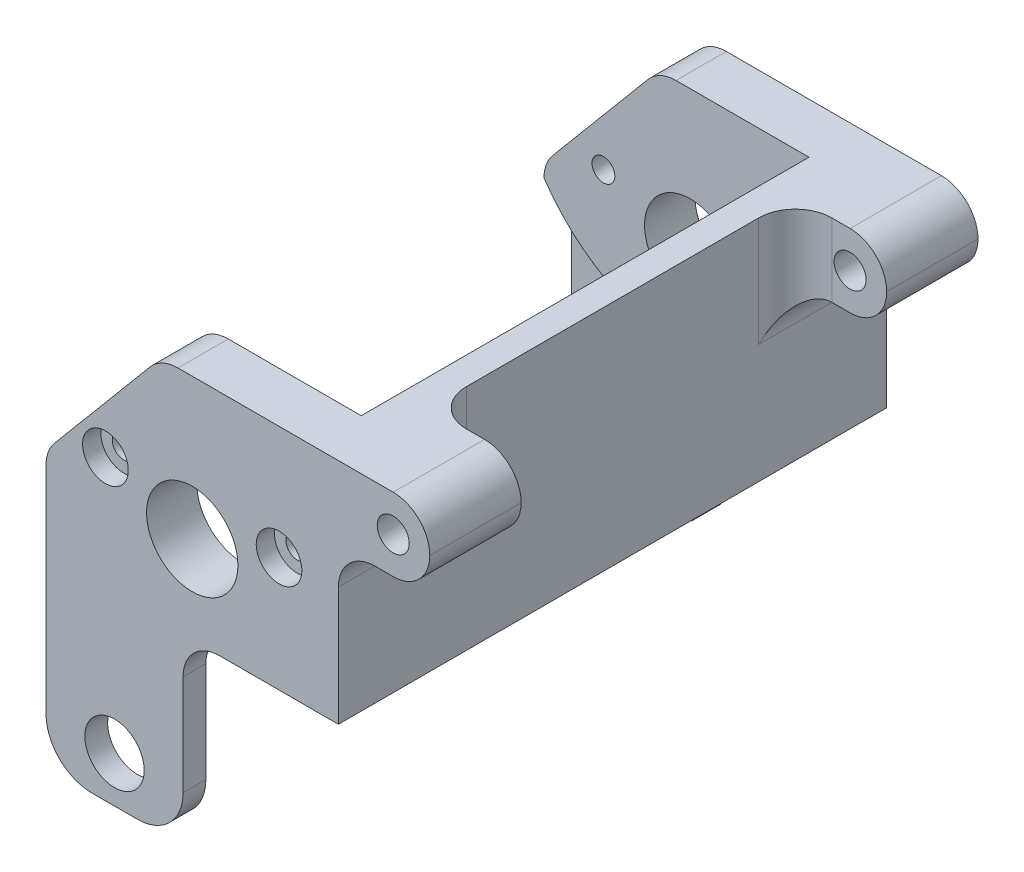
from build123d import *

# Parameters (mm, degrees)
BOSS_EXTRUDE1_DEPTH      = 30
BOSS_EXTRUDE1_DEPTH_BACK = 30
SKETCH2_R                = 3.25
SKETCH2_R_2              = 1.25
SKETCH2_R_3              = 5
SKETCH3_W                = 58
SKETCH3_H                = 55
CUT_EXTRUDE1_DEPTH       = 60.373815778
SKETCH4_W                = 10
SKETCH4_H                = 8
BOSS_EXTRUDE2_DEPTH      = 10
FILLET1_R                = 4
SKETCH5_R                = 1.75
CUT_EXTRUDE2_DEPTH       = 76.599272483
FILLET1_OF_MIRROR1_R     = 4
FILLET2_R                = 4
SKETCH6_R                = 1.25
SKETCH6_R_2              = 5
BOSS_EXTRUDE3_DEPTH      = 3
SKETCH7_R                = 2.5
CUT_EXTRUDE3_DEPTH       = 2


with BuildPart() as part:
    # Sketch2 → Boss-Extrude1 (new, two sides: drawn at the far end of the back side and taken through both)
    with BuildSketch(Plane.XY.offset(-BOSS_EXTRUDE1_DEPTH_BACK)):
        with BuildLine():
            Line((-7.5, 5), (-7.5, 30))
            Line((-7.5, 30), (5.086494468, 45))
            Line((5.086494468, 45), (24.5, 45))
            Line((24.5, 45), (24.5, 20))
            Line((24.5, 20), (7.5, 20))
            Line((7.5, 20), (7.5, 5))
            ThreePointArc((7.5, 5), (6.035533906, 1.464466094), (2.5, 0))
            Line((2.5, 0), (-2.5, 0))
            ThreePointArc((-2.5, 0), (-6.035533906, 1.464466094), (-7.5, 5))
        make_face()
        with Locations((0, 5)):
            Circle(SKETCH2_R, mode=Mode.SUBTRACT)
        with Locations((18.004770913, 32.569673822)):
            Circle(SKETCH2_R_2, mode=Mode.SUBTRACT)
        with Locations((-0.995229087, 32.569673822)):
            Circle(SKETCH2_R_2, mode=Mode.SUBTRACT)
        with Locations((8.504770913, 29.569673822)):
            Circle(SKETCH2_R_3, mode=Mode.SUBTRACT)
    extrude(amount=BOSS_EXTRUDE1_DEPTH + BOSS_EXTRUDE1_DEPTH_BACK)

    # Sketch3 → Cut-Extrude1 (cut, through all)
    with BuildSketch(Plane(origin=(0, 45, 0), x_dir=(1, 0, 0), z_dir=(0, 1, 0))):
        with Locations((-7.5, 0)):
            Rectangle(SKETCH3_W, SKETCH3_H)
    extrude(amount=-CUT_EXTRUDE1_DEPTH, mode=Mode.SUBTRACT)

    # Sketch4 → Boss-Extrude2 (add)
    with BuildSketch(Plane(origin=(24.5, 0, 0), x_dir=(0, 0, -1), z_dir=(1, 0, 0))):
        with Locations((-25, 41)):
            Rectangle(SKETCH4_W, SKETCH4_H)
    boss_extrude2 = extrude(amount=BOSS_EXTRUDE2_DEPTH)

    # Fillet1
    fillet1_edges = [part.edges().sort_by_distance(p)[0] for p in [
        (34.5, 37, 25),
        (34.5, 45, 25),
    ]]
    fillet(fillet1_edges, radius=FILLET1_R - 0.0001)  # a hair under: the kernel refuses the full size

    # Sketch5 → Cut-Extrude2 (cut, through all)
    with BuildSketch(Plane(origin=(0, 0, 20), x_dir=(-1, 0, 0), z_dir=(0, 0, -1))):
        with Locations((-30.5, 41)):
            Circle(SKETCH5_R)
    cut_extrude2 = extrude(amount=-CUT_EXTRUDE2_DEPTH, mode=Mode.SUBTRACT)

    # Mirror1: Boss-Extrude2, Cut-Extrude2 across plane
    add(boss_extrude2.mirror(Plane.XY))
    add(cut_extrude2.mirror(Plane.XY), mode=Mode.SUBTRACT)

    # Fillet1 of Mirror1
    fillet1_of_mirror1_edges = [part.edges().sort_by_distance(p)[0] for p in [
        (34.5, 37, -25),
        (34.5, 45, -25),
    ]]
    fillet(fillet1_of_mirror1_edges, radius=FILLET1_OF_MIRROR1_R - 0.0001)  # a hair under: the kernel refuses the full size

    # Fillet2
    fillet2_edges = [part.edges().sort_by_distance(p)[0] for p in [
        (24.5, 37, 25),
        (24.5, 41, 20),
        (24.5, 37, -25),
        (24.5, 41, -20),
        (5.086494468, 45, -28.75),
        (7.5, 20, -28.75),
        (-7.5, 30, -28.75),
        (-7.5, 30, 28.75),
        (7.5, 20, 28.75),
        (5.086494468, 45, 28.75),
    ]]
    fillet(fillet2_edges, radius=FILLET2_R)

    # Sketch6 → Boss-Extrude3 (add)
    with BuildSketch(Plane.XY.offset(-27.5)):
        with BuildLine():
            Line((21.5, 45), (6.9517251, 45))
            ThreePointArc((6.9517251, 45), (5.261252053, 44.625231148), (3.887547328, 43.571150439))
            Line((3.887547328, 43.571150439), (-6.564177772, 31.115269502))
            ThreePointArc((-6.564177772, 31.115269502), (-7.258770483, 29.912199636), (-7.5, 28.544119063))
            ThreePointArc((-7.5, 28.544119063), (0.776489044, 21.551274863), (11.5, 20))
            Line((11.5, 20), (21.5, 20))
            Line((21.5, 20), (21.5, 45))
        make_face()
        with Locations((18.004770913, 32.569673822)):
            Circle(SKETCH6_R, mode=Mode.SUBTRACT)
        with Locations((8.504770913, 29.569673822)):
            Circle(SKETCH6_R_2, mode=Mode.SUBTRACT)
        with Locations((-0.995229087, 32.569673822)):
            Circle(SKETCH6_R, mode=Mode.SUBTRACT)
    boss_extrude3 = extrude(amount=BOSS_EXTRUDE3_DEPTH)

    # Sketch7 → Cut-Extrude3 (cut)
    with BuildSketch(Plane(origin=(0, 0, -30), x_dir=(-1, 0, 0), z_dir=(0, 0, -1))):
        with Locations((-18.004770913, 32.569673822)):
            Circle(SKETCH7_R)
        with Locations((0.995229087, 32.569673822)):
            Circle(SKETCH7_R)
    cut_extrude3 = extrude(amount=-CUT_EXTRUDE3_DEPTH, mode=Mode.SUBTRACT)

    # Mirror2: Boss-Extrude3, Cut-Extrude3 across plane
    add(boss_extrude3.mirror(Plane.XY))
    add(cut_extrude3.mirror(Plane.XY), mode=Mode.SUBTRACT)


solid = part.part
